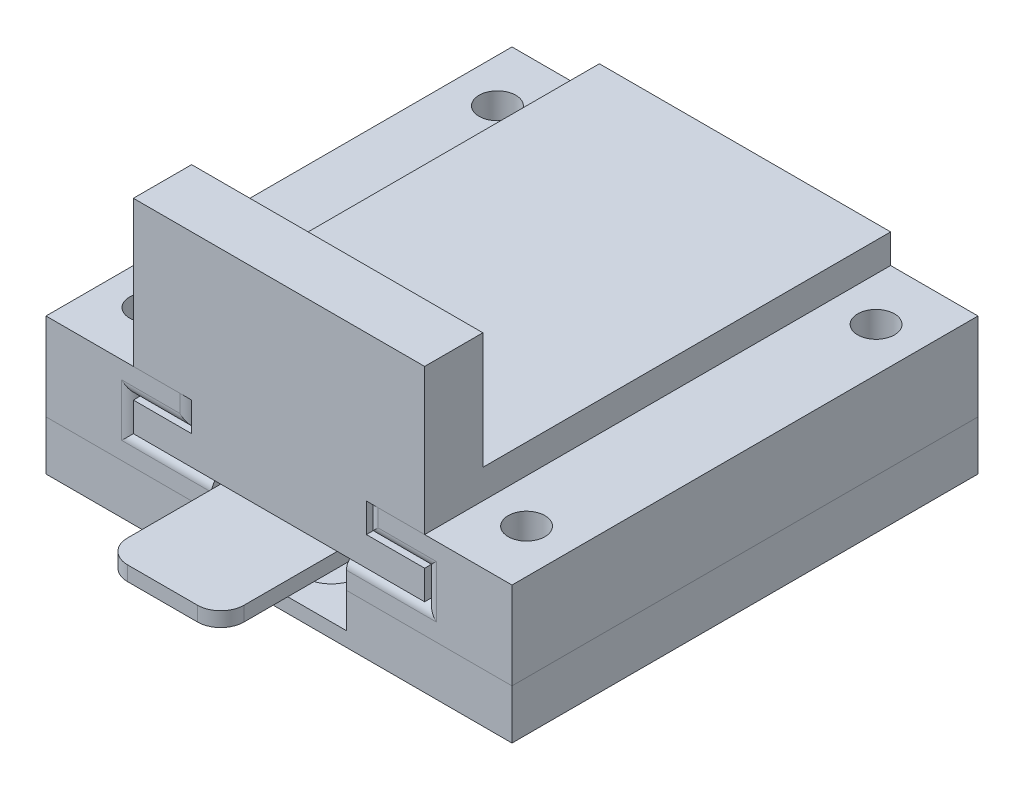
from build123d import *

# Parameters (mm, degrees)
SKETCH1_W               = 50.8
SKETCH1_H               = 50.8
BOSS_EXTRUDE1_DEPTH     = 3.175
BOSS_EXTRUDE5_DEPTH     = 6.35
CUT_EXTRUDE4_DEPTH      = 37.061067996
SKETCH19_W              = 12.7
SKETCH19_H              = 3.175
BOSS_EXTRUDE10_DEPTH    = 12.7
BOSS_EXTRUDE2_DEPTH     = 50.8
BOSS_EXTRUDE6_REACH     = 48.771
SKETCH10_W              = 50.8
SKETCH10_H              = 9.525
SKETCH12_R              = 2
CUT_EXTRUDE2_DEPTH      = 47.770670564
CUT_EXTRUDE5_DEPTH      = 12.7
SKETCH21_R              = 3
CUT_EXTRUDE6_DEPTH      = 0.5
FILLET2_R               = 2.54
BOSS_EXTRUDE11_DEPTH    = 6.35
SKETCH23_W              = 31.75
SKETCH23_H              = 50.8
BOSS_EXTRUDE12_DEPTH    = 3.175
INTERSECT6_START        = -15.875
INTERSECT6_OUTLINE_W    = 3.175
INTERSECT6_OUTLINE_H    = 50.8
INTERSECT6_DEPTH        = 31.75
INTERSECT6_START_2      = -9.525
INTERSECT6_2_OUTLINE_W  = 3.175
INTERSECT6_2_OUTLINE_H  = 41.275
INTERSECT6_2_DEPTH      = 19.05
INTERSECT6_3_DEPTH      = 9.525
INTERSECT6_START_3      = 6.35
INTERSECT6_4_DEPTH      = 9.525
INTERSECT6_5_OUTLINE_R  = 2
INTERSECT6_5_DEPTH      = 9.525
INTERSECT6_START_4      = 1.5875
INTERSECT6_6_OUTLINE_R  = 3
INTERSECT6_6_DEPTH      = 1.5875
INTERSECT6_START_5      = 2.0875
INTERSECT6_7_OUTLINE_R  = 3
INTERSECT6_7_DEPTH      = 1.0875
INTERSECT6_8_OUTLINE_W  = 1.5875
INTERSECT6_8_OUTLINE_H  = 13.335
INTERSECT6_8_DEPTH      = 31.75
INTERSECT6_9_OUTLINE_W  = 1.5875
INTERSECT6_9_OUTLINE_H  = 27.94
INTERSECT6_9_DEPTH      = 8.525
INTERSECT6_START_6      = 7.35
INTERSECT6_10_OUTLINE_W = 1.5875
INTERSECT6_10_OUTLINE_H = 27.94
INTERSECT6_10_DEPTH     = 8.525
INTERSECT6_START_7      = -6.35
INTERSECT6_11_DEPTH     = 12.7
SKETCH24_R              = 2
BOSS_EXTRUDE13_DEPTH    = 3.81
SKETCH26_W              = 50.8
SKETCH26_H              = 50.8
SKETCH26_R              = 2
BOSS_EXTRUDE15_DEPTH    = 1.5875
CUT_EXTRUDE7_START      = -0.508
SKETCH27_R              = 3
CUT_EXTRUDE7_DEPTH      = 0.508
FILLET3_R               = 1.27
FILLET4_R               = 1.27
SKETCH28_W              = 31.75
SKETCH28_H              = 6.35
BOSS_EXTRUDE16_DEPTH    = 12.7


with BuildPart() as part:
    # Sketch1 → Boss-Extrude1 (new body)
    with BuildSketch(Plane(origin=(0, 0, 0), x_dir=(1, 0, 0), z_dir=(0, 1, 0))):
        Rectangle(SKETCH1_W, SKETCH1_H)
    extrude(amount=BOSS_EXTRUDE1_DEPTH)

    # Sketch7 → Boss-Extrude5 (add, symmetric)
    with BuildSketch(Plane(origin=(0, 0, 0), x_dir=(0, 0, -1), z_dir=(1, 0, 0))):
        Polygon((-16.51, 3.175), (-10.16, 5.159375), (-10.16, 3.175), align=None)
    extrude(amount=BOSS_EXTRUDE5_DEPTH, both=True)

    # Sketch18 → Cut-Extrude4 (cut, through all)
    with BuildSketch(Plane(origin=(0, 3.175, 0), x_dir=(1, 0, 0), z_dir=(0, 1, 0))):
        Polygon((7.35, -17.51), (7.35, -10.16), (7.35, 2.54), (6.35, 2.54), (6.35, -10.16), (6.35, -16.51), (6.35, -25.4), (-6.35, -25.4), (-6.35, -16.51), (-6.35, -10.16), (-6.35, 2.54), (-7.35, 2.54), (-7.35, -10.16), (-7.35, -17.51), (-7.35, -29.229001294), (7.35, -29.229001294), align=None)
    extrude(amount=-CUT_EXTRUDE4_DEPTH, mode=Mode.SUBTRACT)

    # Sketch19 → Boss-Extrude10 (add)
    with BuildSketch(Plane.XY.offset(25.4)):
        with Locations((0, 1.5875)):
            Rectangle(SKETCH19_W, SKETCH19_H)
    extrude(amount=BOSS_EXTRUDE10_DEPTH)

    # Sketch3 → Boss-Extrude2 (add)
    with BuildSketch(Plane.XY.offset(25.4)):
        Polygon((-15.875, 3.175), (-25.4, 3.175), (-25.4, 9.525), (-9.525, 9.525), (-9.525, 6.35), (-15.875, 6.35), align=None)
        Polygon((9.525, 6.35), (15.875, 6.35), (15.875, 3.175), (25.4, 3.175), (25.4, 9.525), (9.525, 9.525), align=None)
    extrude(amount=-BOSS_EXTRUDE2_DEPTH)

    # Boss-Extrude6: up to this face of the body (flat: up to its plane)
    boss_extrude6_end = Plane(part.part.faces().sort_by_distance((0, 3.175, -2.992354694))[0])
    # Sketch10 → Boss-Extrude6 (add, up to the picked face)
    with BuildSketch(Plane(origin=(0, 9.525, 0), x_dir=(1, 0, 0), z_dir=(0, 1, 0)), mode=Mode.PRIVATE) as boss_extrude6_sk1:
        with Locations((0, 20.6375)):
            Rectangle(SKETCH10_W, SKETCH10_H)
    boss_extrude6_tool1 = split(extrude(boss_extrude6_sk1.sketch, amount=-BOSS_EXTRUDE6_REACH, mode=Mode.PRIVATE), bisect_by=boss_extrude6_end, keep=Keep.BOTH, mode=Mode.PRIVATE)
    add(boss_extrude6_tool1.solids().sort_by(Axis((0, 9.525, -20.6375), (0, -1, 0)))[0])

    # Sketch12 → Cut-Extrude2 (cut, through all)
    with BuildSketch(Plane(origin=(0, 9.525, 0), x_dir=(1, 0, 0), z_dir=(0, 1, 0))):
        with Locations(Location((-20.6375, -19.05, 0), (0, 0, 270))):
            Circle(SKETCH12_R)
        with Locations(Location((20.6375, -19.05, 0), (0, 0, 90))):
            Circle(SKETCH12_R)
        with Locations(Location((20.6375, 19.05, 0), (0, 0, 270))):
            Circle(SKETCH12_R)
        with Locations(Location((-20.6375, 19.05, 0), (0, 0, 90))):
            Circle(SKETCH12_R)
    extrude(amount=-CUT_EXTRUDE2_DEPTH, mode=Mode.SUBTRACT)

    # Sketch20 → Cut-Extrude5 (cut)
    with BuildSketch(Plane(origin=(6.35, 0, 0), x_dir=(0, 0, -1), z_dir=(1, 0, 0))):
        Polygon((2.54, 0), (-0.209630657, 1.5875), (-38.1, 1.5875), (-38.1, 0), align=None)
    extrude(amount=-CUT_EXTRUDE5_DEPTH, mode=Mode.SUBTRACT)

    # Sketch21 → Cut-Extrude6 (cut)
    with BuildSketch(Plane.XZ.offset(-1.5875)):
        with Locations(Location((0, 19.685, 0), (0, 0, 270))):
            Circle(SKETCH21_R)
    extrude(amount=-CUT_EXTRUDE6_DEPTH, mode=Mode.SUBTRACT)

    # Fillet2
    fillet2_edges = [part.edges().sort_by_distance(p)[0] for p in [
        (6.35, 2.38125, 38.1),
        (-6.35, 2.38125, 38.1),
    ]]
    fillet(fillet2_edges, radius=FILLET2_R)

    # Fillet3
    fillet3_edges = [part.edges().sort_by_distance(p)[0] for p in [
        (9.525, 7.9375, 25.4),
        (12.7, 6.35, 25.4),
        (15.875, 4.7625, 25.4),
        (11.6125, 3.175, 25.4),
        (-11.6125, 3.175, 25.4),
        (-15.875, 4.7625, 25.4),
        (-12.7, 6.35, 25.4),
        (-9.525, 7.9375, 25.4),
    ]]
    fillet(fillet3_edges, radius=FILLET3_R)


with BuildPart() as body_2:
    # Sketch22 → Boss-Extrude11 (new body)
    with BuildSketch(Plane(origin=(0, 3.175, 0), x_dir=(1, 0, 0), z_dir=(0, 1, 0))):
        Polygon((-7.35, -25.4), (7.35, -25.4), (15.875, -25.4), (15.875, 15.875), (-15.875, 15.875), (-15.875, -25.4), align=None)
    extrude(amount=BOSS_EXTRUDE11_DEPTH)

    # Sketch23 → Boss-Extrude12 (add)
    with BuildSketch(Plane(origin=(0, 9.525, 0), x_dir=(1, 0, 0), z_dir=(0, 1, 0))):
        Rectangle(SKETCH23_W, SKETCH23_H)
    extrude(amount=BOSS_EXTRUDE12_DEPTH)


with BuildPart() as body_3:
    # Intersect6: read off the stored shape, not the designer's step
    # Intersect6 outline → Intersect6 (new body)
    with BuildSketch(Plane.YZ.offset(INTERSECT6_START)):
        Polygon((3.175, 10.16), (3.175, -15.875), (6.35, -15.875), (6.35, 25.4), (3.175, 25.4), (3.175, 16.51), (5.159375, 10.16), align=None)
        with Locations((11.1125, 0)):
            Rectangle(INTERSECT6_OUTLINE_W, INTERSECT6_OUTLINE_H)
    extrude(amount=INTERSECT6_DEPTH)

    # Intersect6 2 outline → Intersect6 2 (add)
    with BuildSketch(Plane.YZ.offset(INTERSECT6_START_2)):
        with Locations((7.9375, 4.7625)):
            Rectangle(INTERSECT6_2_OUTLINE_W, INTERSECT6_2_OUTLINE_H)
    extrude(amount=INTERSECT6_2_DEPTH)

    # Intersect6 3 outline → Intersect6 3 (add)
    with BuildSketch(Plane.YZ.offset(INTERSECT6_START)):
        Polygon((3.175, 16.51), (3.175, 10.16), (5.159375, 10.16), align=None)
    extrude(amount=INTERSECT6_3_DEPTH)

    # Intersect6 4 outline → Intersect6 4 (add)
    with BuildSketch(Plane.YZ.offset(INTERSECT6_START_3)):
        Polygon((3.175, 16.51), (3.175, 10.16), (5.159375, 10.16), align=None)
    extrude(amount=INTERSECT6_4_DEPTH)

    # Fillet4
    fillet4_edges = [body_3.edges().sort_by_distance(p)[0] for p in [
        (12.7, 6.35, -15.875),
        (-15.875, 4.7625, -15.875),
        (-9.525, 7.9375, -15.875),
        (-12.7, 6.35, -15.875),
        (9.525, 7.9375, -15.875),
        (15.875, 4.7625, -15.875),
        (0, 3.175, -15.875),
    ]]
    fillet(fillet4_edges, radius=FILLET4_R)

    # Sketch28 → Boss-Extrude16 (add)
    with BuildSketch(Plane(origin=(0, 12.7, 0), x_dir=(1, 0, 0), z_dir=(0, 1, 0))):
        with Locations((0, -22.225)):
            Rectangle(SKETCH28_W, SKETCH28_H)
    extrude(amount=BOSS_EXTRUDE16_DEPTH)


with BuildPart() as body_4:
    # Intersect6 5 outline → Intersect6 5 (new body)
    with BuildSketch(Plane(origin=(0, 0, 0), x_dir=(1, 0, 0), z_dir=(0, 1, 0))):
        Polygon((-15.875, 15.875), (15.875, 15.875), (15.875, -25.4), (25.4, -25.4), (25.4, 25.4), (-25.4, 25.4), (-25.4, -25.4), (-15.875, -25.4), align=None)
        with Locations((-20.6375, -19.05)):
            Circle(INTERSECT6_5_OUTLINE_R, mode=Mode.SUBTRACT)
        with Locations((20.6375, -19.05)):
            Circle(INTERSECT6_5_OUTLINE_R, mode=Mode.SUBTRACT)
        with Locations((-20.6375, 19.05)):
            Circle(INTERSECT6_5_OUTLINE_R, mode=Mode.SUBTRACT)
        with Locations((20.6375, 19.05)):
            Circle(INTERSECT6_5_OUTLINE_R, mode=Mode.SUBTRACT)
    extrude(amount=INTERSECT6_5_DEPTH)

    # Intersect6 6 outline → Intersect6 6 (add)
    with BuildSketch(Plane(origin=(0, 0, 0), x_dir=(1, 0, 0), z_dir=(0, 1, 0)).offset(INTERSECT6_START_4)):
        with BuildLine():
            Line((15.875, -25.4), (15.875, 15.875))
            Line((15.875, 15.875), (-15.875, 15.875))
            Line((-15.875, 15.875), (-15.875, -25.4))
            Line((-15.875, -25.4), (-7.35, -25.4))
            Line((-7.35, -25.4), (-7.35, 2.54))
            Line((-7.35, 2.54), (-6.35, 2.54))
            Line((-6.35, 2.54), (-6.35, -35.56))
            ThreePointArc((-6.35, -35.56), (-5.606051224, -37.356051224), (-3.81, -38.1))
            Line((-3.81, -38.1), (3.81, -38.1))
            ThreePointArc((3.81, -38.1), (5.606051224, -37.356051224), (6.35, -35.56))
            Line((6.35, -35.56), (6.35, 2.54))
            Line((6.35, 2.54), (7.35, 2.54))
            Line((7.35, 2.54), (7.35, -25.4))
            Line((7.35, -25.4), (15.875, -25.4))
        make_face()
        with Locations((0, -19.685)):
            Circle(INTERSECT6_6_OUTLINE_R, mode=Mode.SUBTRACT)
    extrude(amount=INTERSECT6_6_DEPTH)

    # Intersect6 7 outline → Intersect6 7 (add)
    with BuildSketch(Plane(origin=(0, 0, 0), x_dir=(1, 0, 0), z_dir=(0, 1, 0)).offset(INTERSECT6_START_5)):
        with Locations((0, -19.685)):
            Circle(INTERSECT6_7_OUTLINE_R)
    extrude(amount=INTERSECT6_7_DEPTH)

    # Intersect6 8 outline → Intersect6 8 (add)
    with BuildSketch(Plane.YZ.offset(INTERSECT6_START)):
        with Locations((0.79375, -9.2075)):
            Rectangle(INTERSECT6_8_OUTLINE_W, INTERSECT6_8_OUTLINE_H)
    extrude(amount=INTERSECT6_8_DEPTH)

    # Intersect6 9 outline → Intersect6 9 (add)
    with BuildSketch(Plane.YZ.offset(INTERSECT6_START)):
        with Locations((0.79375, 11.43)):
            Rectangle(INTERSECT6_9_OUTLINE_W, INTERSECT6_9_OUTLINE_H)
    extrude(amount=INTERSECT6_9_DEPTH)

    # Intersect6 10 outline → Intersect6 10 (add)
    with BuildSketch(Plane.YZ.offset(INTERSECT6_START_6)):
        with Locations((0.79375, 11.43)):
            Rectangle(INTERSECT6_10_OUTLINE_W, INTERSECT6_10_OUTLINE_H)
    extrude(amount=INTERSECT6_10_DEPTH)

    # Intersect6 11 outline → Intersect6 11 (add)
    with BuildSketch(Plane.YZ.offset(INTERSECT6_START_7)):
        Polygon((1.5875, 0.209630657), (0, -2.54), (1.5875, -2.54), align=None)
    extrude(amount=INTERSECT6_11_DEPTH)


with BuildPart() as body_3_2:
    # Sketch24 → Boss-Extrude13 (new body)
    with BuildSketch(Plane.XZ):
        Polygon((7.35, -2.54), (6.35, -2.54), (-6.35, -2.54), (-7.35, -2.54), (-7.35, 25.4), (-25.4, 25.4), (-25.4, -25.4), (25.4, -25.4), (25.4, 25.4), (7.35, 25.4), align=None)
        with Locations(Location((20.6375, 19.05, 0), (0, 0, 90))):
            Circle(SKETCH24_R, mode=Mode.SUBTRACT)
        with Locations(Location((20.6375, -19.05, 0), (0, 0, 90))):
            Circle(SKETCH24_R, mode=Mode.SUBTRACT)
        with Locations(Location((-20.6375, -19.05, 0), (0, 0, 90))):
            Circle(SKETCH24_R, mode=Mode.SUBTRACT)
        with Locations(Location((-20.6375, 19.05, 0), (0, 0, 90))):
            Circle(SKETCH24_R, mode=Mode.SUBTRACT)
    extrude(amount=BOSS_EXTRUDE13_DEPTH)

    # Sketch26 → Boss-Extrude15 (add)
    with BuildSketch(Plane.XZ.offset(3.81)):
        Rectangle(SKETCH26_W, SKETCH26_H)
        with Locations(Location((-20.6375, -19.05, 0), (0, 0, 90))):
            Circle(SKETCH26_R, mode=Mode.SUBTRACT)
        with Locations(Location((20.6375, -19.05, 0), (0, 0, 90))):
            Circle(SKETCH26_R, mode=Mode.SUBTRACT)
        with Locations(Location((20.6375, 19.05, 0), (0, 0, 90))):
            Circle(SKETCH26_R, mode=Mode.SUBTRACT)
        with Locations(Location((-20.6375, 19.05, 0), (0, 0, 90))):
            Circle(SKETCH26_R, mode=Mode.SUBTRACT)
    extrude(amount=BOSS_EXTRUDE15_DEPTH)

    # Sketch27 → Cut-Extrude7 (cut)
    with BuildSketch(Plane(origin=(0, -3.81, 0), x_dir=(1, 0, 0), z_dir=(0, 1, 0)).offset(CUT_EXTRUDE7_START)):
        with Locations(Location((0, -19.685, 0), (0, 0, 270))):
            Circle(SKETCH27_R)
    extrude(amount=CUT_EXTRUDE7_DEPTH, mode=Mode.SUBTRACT)


solid = Compound([part.part, body_3.part, body_3_2.part])
